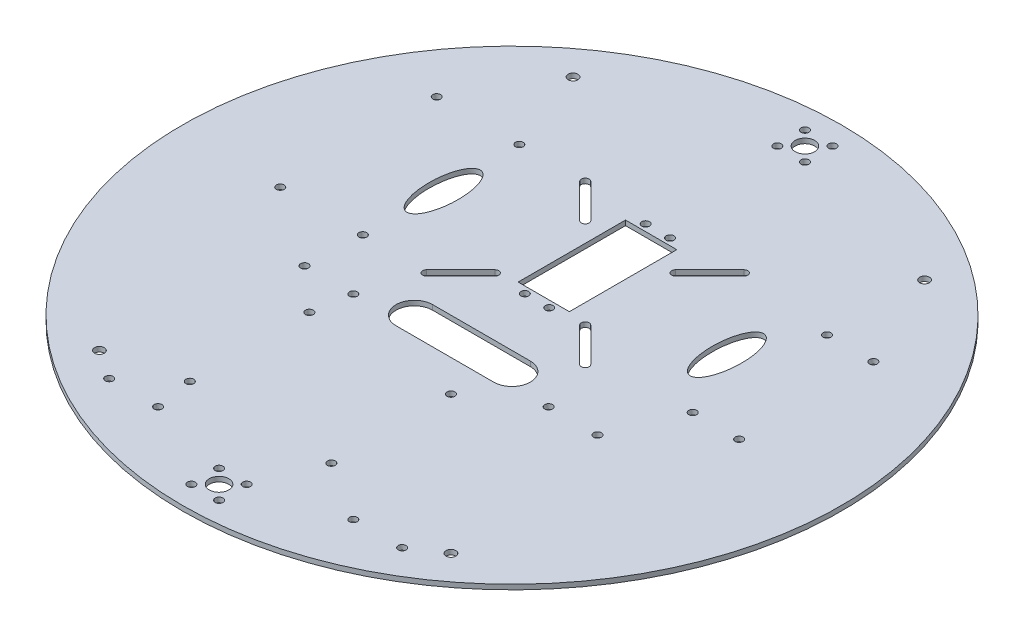
from build123d import *

# Parameters (mm, degrees)
SKETCH_1_R          = 135
EXTRUDE_1_DEPTH     = 2
SKETCH_561_R        = 1.6
SKETCH_561_W        = 21
SKETCH_561_H        = 44
CUT_EXTRUDE_1_DEPTH = 10
SKETCH_1030_R       = 1.6
CUT_EXTRUDE_2_DEPTH = 10
SKETCH_4_R          = 2
SKETCH_4_R_2        = 4
SKETCH_4_R_3        = 1.6
CUT_EXTRUDE_3_DEPTH = 10
CUT_EXTRUDE_4_DEPTH = 10
SKETCH_6_R          = 1.6
SKETCH_6_RX         = 15
SKETCH_6_RY         = 6
CUT_EXTRUDE_7_DEPTH = 10


with BuildPart() as part:
    # 草图1 → 凸台-拉伸1 (new body)
    with BuildSketch(Plane(origin=(0, 0, 0), x_dir=(1, 0, 0), z_dir=(0, 1, 0))):
        Circle(SKETCH_1_R)
    extrude(amount=EXTRUDE_1_DEPTH)

    # Sketch 561 → 切除-拉伸1 (cut)
    with BuildSketch(Plane(origin=(0, 2, 0), x_dir=(1, 0, 0), z_dir=(0, 1, 0))):
        with Locations((-5, 59.75)):
            Circle(SKETCH_561_R)
        with Locations((5, 59.75)):
            Circle(SKETCH_561_R)
        with Locations((-5, 10.25)):
            Circle(SKETCH_561_R)
        with Locations((5, 10.25)):
            Circle(SKETCH_561_R)
        with Locations((18.5, 48.5)):
            Circle(SKETCH_561_R)
        with Locations((18.5, 11.5)):
            Circle(SKETCH_561_R)
        with Locations((-18.5, 11.5)):
            Circle(SKETCH_561_R)
        with Locations((-18.5, 48.5)):
            Circle(SKETCH_561_R)
        with Locations((0, 35)):
            Rectangle(SKETCH_561_W, SKETCH_561_H)
    extrude(amount=-CUT_EXTRUDE_1_DEPTH, mode=Mode.SUBTRACT)

    # Sketch 1030 → 切除-拉伸2 (cut)
    with BuildSketch(Plane(origin=(0, 2, 0), x_dir=(1, 0, 0), z_dir=(0, 1, 0))):
        with Locations((-60, -25)):
            Circle(SKETCH_1030_R)
        with Locations((-40, -25)):
            Circle(SKETCH_1030_R)
        with Locations((40, -25)):
            Circle(SKETCH_1030_R)
        with Locations((60, -25)):
            Circle(SKETCH_1030_R)
        with Locations((60, -105)):
            Circle(SKETCH_1030_R)
        with Locations((40, -105)):
            Circle(SKETCH_1030_R)
        with Locations((-40, -105)):
            Circle(SKETCH_1030_R)
        with Locations((-60, -105)):
            Circle(SKETCH_1030_R)
        with Locations((-42.5, -89.5)):
            Circle(SKETCH_1030_R)
        with Locations((-42.5, -40.5)):
            Circle(SKETCH_1030_R)
        with Locations((15.5, -40.5)):
            Circle(SKETCH_1030_R)
        with Locations((15.5, -89.5)):
            Circle(SKETCH_1030_R)
    extrude(amount=-CUT_EXTRUDE_2_DEPTH, mode=Mode.SUBTRACT)

    # 草图4 → 切除-拉伸3 (cut)
    with BuildSketch(Plane(origin=(0, 2, 0), x_dir=(1, 0, 0), z_dir=(0, 1, 0))):
        with Locations((-72, 97)):
            Circle(SKETCH_4_R)
        with Locations((72, 97)):
            Circle(SKETCH_4_R)
        with Locations((72, -97)):
            Circle(SKETCH_4_R)
        with Locations((-72, -97)):
            Circle(SKETCH_4_R)
        with Locations((0, -120)):
            Circle(SKETCH_4_R_2)
        with Locations((-5.656854249, -125.656854249)):
            Circle(SKETCH_4_R_3)
        with Locations((-5.656854249, -114.343145751)):
            Circle(SKETCH_4_R_3)
        with Locations((5.656854249, -114.343145751)):
            Circle(SKETCH_4_R_3)
        with Locations((5.656854249, -125.656854249)):
            Circle(SKETCH_4_R_3)
        with Locations((5.656854249, 125.656854249)):
            Circle(SKETCH_4_R_3)
        with Locations((5.656854249, 114.343145751)):
            Circle(SKETCH_4_R_3)
        with Locations((-5.656854249, 114.343145751)):
            Circle(SKETCH_4_R_3)
        with Locations((-5.656854249, 125.656854249)):
            Circle(SKETCH_4_R_3)
        with Locations((0, 120)):
            Circle(SKETCH_4_R_2)
        with BuildLine():
            Line((-20, -12.5), (20, -12.5))
            ThreePointArc((20, -12.5), (27.5, -20), (20, -27.5))
            Line((20, -27.5), (-20, -27.5))
            ThreePointArc((-20, -27.5), (-27.5, -20), (-20, -12.5))
        make_face()
    extrude(amount=-CUT_EXTRUDE_3_DEPTH, mode=Mode.SUBTRACT)

    # 草图5 → 切除-拉伸4 (cut)
    with BuildSketch(Plane(origin=(0, 2, 0), x_dir=(1, 0, 0), z_dir=(0, 1, 0))):
        with BuildLine():
            Line((-31.36862915, 63.63137085), (-17.36862915, 49.63137085))
            ThreePointArc((-17.36862915, 49.63137085), (-17.36862915, 47.36862915), (-19.63137085, 47.36862915))
            Line((-19.63137085, 47.36862915), (-33.63137085, 61.36862915))
            ThreePointArc((-33.63137085, 61.36862915), (-33.63137085, 63.63137085), (-31.36862915, 63.63137085))
        make_face()
        with BuildLine():
            Line((33.63137085, 61.36862915), (19.63137085, 47.36862915))
            ThreePointArc((19.63137085, 47.36862915), (17.36862915, 47.36862915), (17.36862915, 49.63137085))
            Line((17.36862915, 49.63137085), (31.36862915, 63.63137085))
            ThreePointArc((31.36862915, 63.63137085), (33.63137085, 63.63137085), (33.63137085, 61.36862915))
        make_face()
        with BuildLine():
            Line((31.36862915, -3.63137085), (17.36862915, 10.36862915))
            ThreePointArc((17.36862915, 10.36862915), (17.36862915, 12.63137085), (19.63137085, 12.63137085))
            Line((19.63137085, 12.63137085), (33.63137085, -1.36862915))
            ThreePointArc((33.63137085, -1.36862915), (33.63137085, -3.63137085), (31.36862915, -3.63137085))
        make_face()
        with BuildLine():
            Line((-33.63137085, -1.36862915), (-19.63137085, 12.63137085))
            ThreePointArc((-19.63137085, 12.63137085), (-17.36862915, 12.63137085), (-17.36862915, 10.36862915))
            Line((-17.36862915, 10.36862915), (-31.36862915, -3.63137085))
            ThreePointArc((-31.36862915, -3.63137085), (-33.63137085, -3.63137085), (-33.63137085, -1.36862915))
        make_face()
    extrude(amount=-CUT_EXTRUDE_4_DEPTH, mode=Mode.SUBTRACT)

    # 草图6 → 切除-拉伸7 (cut)
    with BuildSketch(Plane(origin=(0, 2, 0), x_dir=(1, 0, 0), z_dir=(0, 1, 0))):
        with Locations((71.537199543, 2.5)):
            Circle(SKETCH_6_R)
        with Locations((90.537199543, 2.5)):
            Circle(SKETCH_6_R)
        with Locations((90.537199543, 57.5)):
            Circle(SKETCH_6_R)
        with Locations((71.537199543, 57.5)):
            Circle(SKETCH_6_R)
        with Locations((-92.885957975, -2.05)):
            Circle(SKETCH_6_R)
        with Locations((-59.045957975, -2.05)):
            Circle(SKETCH_6_R)
        with Locations((-92.885957975, 62.05)):
            Circle(SKETCH_6_R)
        with Locations((-59.045957975, 62.05)):
            Circle(SKETCH_6_R)
        with Locations(Location((-58.031053316, 30), (0, 0, -90))):
            Ellipse(SKETCH_6_RX, SKETCH_6_RY)
        with Locations(Location((58.031053316, 30), (0, 0, 90))):
            Ellipse(SKETCH_6_RX, SKETCH_6_RY)
    extrude(amount=-CUT_EXTRUDE_7_DEPTH, mode=Mode.SUBTRACT)


solid = part.part
